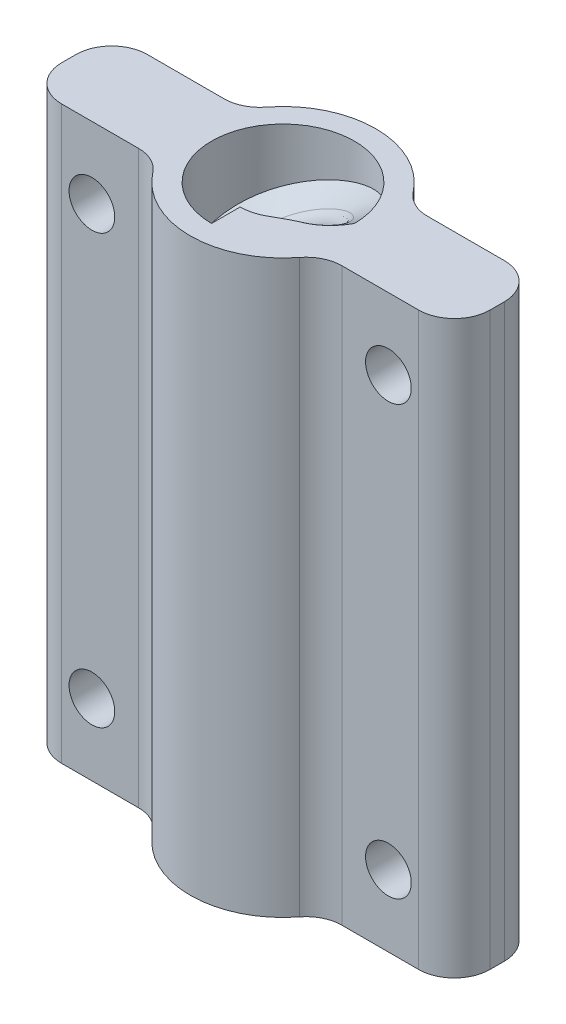
from build123d import *

# Parameters (mm, degrees)
SKETCH1_W           = 30
SKETCH1_H           = 6
BOSS_EXTRUDE1_DEPTH = 20
SKETCH2_R           = 6.5
BOSS_EXTRUDE2_DEPTH = 40
SKETCH3_R           = 1.6
CUT_EXTRUDE1_DEPTH  = 27.744158241
SKETCH4_R           = 5
CUT_EXTRUDE2_DEPTH  = 44.211688234
SWEEP1_PITCH        = 10
SKETCH7_W           = 52.540479354
SKETCH7_H           = 26.188764024
CUT_EXTRUDE3_DEPTH  = 46.535862079
SKETCH8_W           = 69.667755792
SKETCH8_H           = 35.952960448
CUT_EXTRUDE4_DEPTH  = 44.211688931
FILLET1_R           = 2.5
FILLET2_R           = 2.5


with BuildPart() as part:
    # Sketch1 → Boss-Extrude1 (new, symmetric)
    with BuildSketch(Plane(origin=(0, 0, 0), x_dir=(1, 0, 0), z_dir=(0, 1, 0))):
        Rectangle(SKETCH1_W, SKETCH1_H)
    extrude(amount=BOSS_EXTRUDE1_DEPTH, both=True)

    # Sketch2 → Boss-Extrude2 (add)
    with BuildSketch(Plane(origin=(0, 20, 0), x_dir=(1, 0, 0), z_dir=(0, 1, 0))):
        Circle(SKETCH2_R)
    extrude(amount=-BOSS_EXTRUDE2_DEPTH)

    # Sketch3 → Cut-Extrude1 (cut, through all)
    with BuildSketch(Plane(origin=(0, 0, -3), x_dir=(-1, 0, 0), z_dir=(0, 0, -1))):
        with Locations((-10.383140649, 15)):
            Circle(SKETCH3_R)
        with Locations((-10.383140649, -15)):
            Circle(SKETCH3_R)
    cut_extrude1 = extrude(amount=-CUT_EXTRUDE1_DEPTH, mode=Mode.SUBTRACT)

    # Mirror1: Cut-Extrude1 across plane
    add(cut_extrude1.mirror(Plane(origin=(0, 0, 0), x_dir=(0, 0, 1), z_dir=(1, 0, 0))), mode=Mode.SUBTRACT)

    # Sketch4 → Cut-Extrude2 (cut, through all)
    with BuildSketch(Plane(origin=(0, 20, 0), x_dir=(1, 0, 0), z_dir=(0, 1, 0))):
        with Locations(Location((0, 0, 0), (0, 0, 270))):
            Circle(SKETCH4_R)
    extrude(amount=-CUT_EXTRUDE2_DEPTH, mode=Mode.SUBTRACT)

    # Sweep1: the profile of Sketch6 profile screwed along a left-hand helix of 4 turns, 16 arcs to a turn; built about Z, then put on its axis
    sweep1_z = Axis((0, 0, 0), (0, 0, 1))
    sweep1_corners = [(5.0003, 0, -2.500173205), (5.0003, 0, 2.500173205), (3.5, 0, 1.633974596), (3, 0, 0.767949192), (3, 0, -0.767949192), (3.5, 0, -1.633974596)]
    with BuildLine(mode=Mode.PRIVATE) as sweep1_profile:
        Line(sweep1_corners[0], sweep1_corners[1])
        Line(sweep1_corners[1], sweep1_corners[2])
        Line(sweep1_corners[3], sweep1_corners[4])
        Line(sweep1_corners[5], sweep1_corners[0])
        ThreePointArc((3.5, 0, 1.633974596), (3.133974596, 0, 1.267949192), (3, 0, 0.767949192))
        ThreePointArc((3, 0, -0.767949192), (3.133974596, 0, -1.267949192), (3.5, 0, -1.633974596))
    sweep1_cap = Face(sweep1_profile.wire())
    sweep1_arcs = [((3.5, 0, 1.633974596), (3, 0, 1.345299462), (3, 0, 0.767949192), (1, 0.8660254037844394, 1)), ((3, 0, -0.767949192), (3, 0, -1.345299462), (3.5, 0, -1.633974596), (1, 0.8660254037844386, 1))]  # start, shoulder, end, weights
    sweep1_turn_angles = [0, -11.25, -22.5, -33.75, -45, -56.25, -67.5, -78.75, -90, -101.25, -112.5, -123.75, -135, -146.25, -157.5, -168.75, -180, -191.25, -202.5, -213.75, -225, -236.25, -247.5, -258.75, -270, -281.25, -292.5, -303.75, -315, -326.25, -337.5, -348.75, -360]
    sweep1_turn_weights = [1, 0.9807852804032304, 1, 0.9807852804032304, 1, 0.9807852804032304, 1, 0.9807852804032304, 1, 0.9807852804032304, 1, 0.9807852804032304, 1, 0.9807852804032304, 1, 0.9807852804032304, 1, 0.9807852804032304, 1, 0.9807852804032304, 1, 0.9807852804032304, 1, 0.9807852804032304, 1, 0.9807852804032304, 1, 0.9807852804032304, 1, 0.9807852804032304, 1, 0.9807852804032304, 1]
    sweep1_turn_rails = [Edge.make_bspline([Vector(p[0], p[1], 0).rotate(sweep1_z, sweep1_turn_angles[k]) / sweep1_turn_weights[k] + Vector(0, 0, p[2] + -SWEEP1_PITCH * sweep1_turn_angles[k] / 360) for k in range(33)], [0, 0, 0, 1, 1, 2, 2, 3, 3, 4, 4, 5, 5, 6, 6, 7, 7, 8, 8, 9, 9, 10, 10, 11, 11, 12, 12, 13, 13, 14, 14, 15, 15, 16, 16, 16], 2, sweep1_turn_weights) for p in sweep1_corners]
    sweep1_turn_sides = [*[Face.make_surface_from_curves(sweep1_turn_rails[p[0]], sweep1_turn_rails[p[1]]) for p in [(0, 1), (1, 2), (3, 4), (5, 0)]], *[Face.make_bezier_surface([[Vector(p[j][0], p[j][1], 0).rotate(sweep1_z, sweep1_turn_angles[2 * i + k]) / sweep1_turn_weights[2 * i + k] + Vector(0, 0, p[j][2] + -SWEEP1_PITCH * sweep1_turn_angles[2 * i + k] / 360) for k in range(3)] for j in range(3)], [[p[3][j] * sweep1_turn_weights[2 * i + k] for k in range(3)] for j in range(3)]) for p in sweep1_arcs for i in range(16)]]
    sweep1 = Plane(origin=(0, 20, 0), x_dir=(0, 0, 1), z_dir=(0, -1, 0)) * Solid(Shell([*[p.moved(Location((0, 0, SWEEP1_PITCH * i))) for i in range(4) for p in sweep1_turn_sides], sweep1_cap, sweep1_cap.rotate(sweep1_z, -1440).moved(Location((0, 0, -SWEEP1_PITCH * -1440 / 360)))]))
    add(sweep1)

    # Sketch7 → Cut-Extrude3 (cut, through all)
    with BuildSketch(Plane.XZ.offset(20)):
        Rectangle(SKETCH7_W, SKETCH7_H)
    extrude(amount=CUT_EXTRUDE3_DEPTH, mode=Mode.SUBTRACT)

    # Sketch8 → Cut-Extrude4 (cut, through all)
    with BuildSketch(Plane(origin=(0, 20, 0), x_dir=(1, 0, 0), z_dir=(0, 1, 0))):
        Rectangle(SKETCH8_W, SKETCH8_H)
    extrude(amount=CUT_EXTRUDE4_DEPTH, mode=Mode.SUBTRACT)

    # Fillet1
    fillet1_edges = [part.edges().sort_by_distance(p)[0] for p in [
        (5.766281297, 0, -3),
        (5.766281297, 0, 3),
        (-5.766281297, 0, -3),
        (-5.766281297, 0, 3),
    ]]
    fillet(fillet1_edges, radius=FILLET1_R)

    # Fillet2
    fillet2_edges = [part.edges().sort_by_distance(p)[0] for p in [
        (15, 0, 3),
        (-15, 0, 3),
        (-15, 0, -3),
        (15, 0, -3),
    ]]
    fillet(fillet2_edges, radius=FILLET2_R)


solid = part.part
